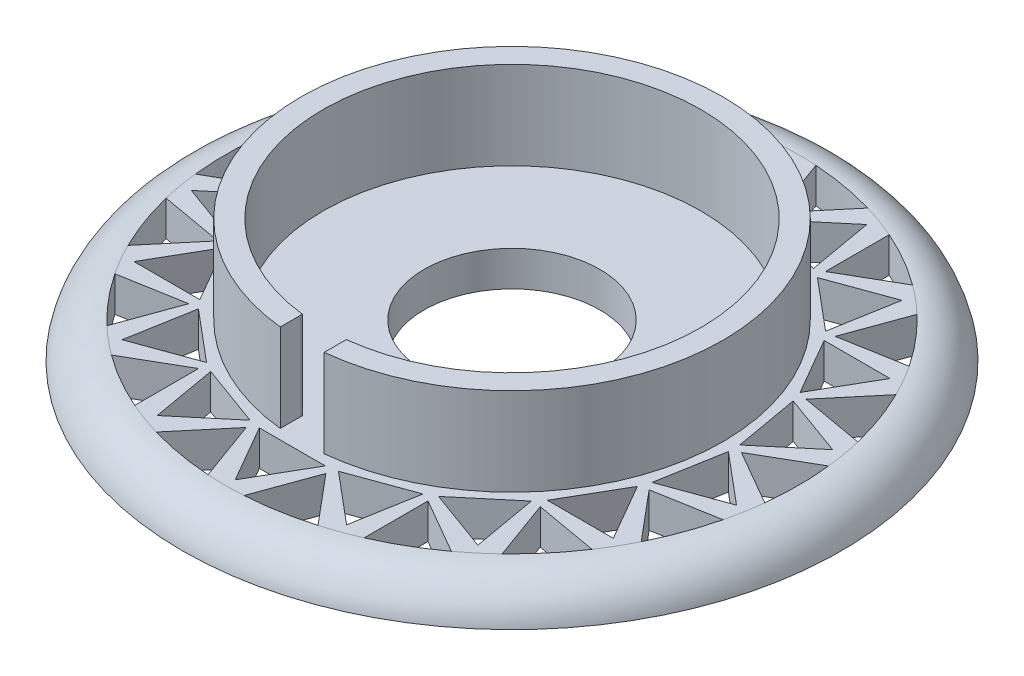
from build123d import *

# Parameters (mm, degrees)
SKETCH1_R           = 75
BOSS_EXTRUDE1_DEPTH = 8
SKETCH2_R           = 48
SKETCH2_R_2         = 43
BOSS_EXTRUDE3_DEPTH = 20
CUT_EXTRUDE2_START  = -20
CUT_EXTRUDE2_DEPTH  = 20
FILLET1_R           = 10
CUT_EXTRUDE3_DEPTH  = 108.935165725
CIRPATTERN1_COUNT   = 18
SKETCH9_R           = 20
CUT_EXTRUDE4_DEPTH  = 108.935165725


with BuildPart() as part:
    # Sketch1 → Boss-Extrude1 (new body)
    with BuildSketch(Plane(origin=(0, 0, 0), x_dir=(1, 0, 0), z_dir=(0, 1, 0))):
        with Locations(Location((0, 0, 0), (0, 0, 270))):
            Circle(SKETCH1_R)
    extrude(amount=BOSS_EXTRUDE1_DEPTH)

    # Sketch2 → Boss-Extrude3 (add)
    with BuildSketch(Plane(origin=(0, 8, 0), x_dir=(1, 0, 0), z_dir=(0, 1, 0))):
        with Locations(Location((0, 0, 0), (0, 0, 270))):
            Circle(SKETCH2_R)
        with Locations(Location((0, 0, 0), (0, 0, 270))):
            Circle(SKETCH2_R_2, mode=Mode.SUBTRACT)
    extrude(amount=BOSS_EXTRUDE3_DEPTH)

    # Sketch7 → Cut-Extrude2 (cut)
    with BuildSketch(Plane(origin=(0, 28, 0), x_dir=(1, 0, 0), z_dir=(0, 1, 0)).offset(CUT_EXTRUDE2_START)):
        with BuildLine():
            Line((0, -43), (-5, -43))
            Line((-5, -43), (-5, -47.738873049))
            ThreePointArc((-5, -47.738873049), (-2.503407043, -47.934673809), (0, -48))
            ThreePointArc((0, -48), (2.503407043, -47.934673809), (5, -47.738873049))
            Line((5, -47.738873049), (5, -43))
            Line((5, -43), (0, -43))
        make_face()
        with BuildLine():
            ThreePointArc((0, -48), (-2.503407043, -47.934673809), (-5, -47.738873049))
            Line((-5, -47.738873049), (-5, -48))
            Line((-5, -48), (0, -48))
        make_face()
        with BuildLine():
            ThreePointArc((5, -47.738873049), (2.503407043, -47.934673809), (0, -48))
            Line((0, -48), (5, -48))
            Line((5, -48), (5, -47.738873049))
        make_face()
        with BuildLine():
            ThreePointArc((4.966536902, -42.712217353), (2.4874338, -42.927994049), (0, -43))
            Line((0, -43), (5, -43))
            Line((5, -43), (4.966536902, -42.712217353))
        make_face()
        with BuildLine():
            Line((-4.966536902, -42.712217353), (-5, -43))
            Line((-5, -43), (0, -43))
            ThreePointArc((0, -43), (-2.4874338, -42.927994049), (-4.966536902, -42.712217353))
        make_face()
    extrude(amount=CUT_EXTRUDE2_DEPTH, mode=Mode.SUBTRACT)

    # Fillet1
    # the kernel refuses this fillet: 10 mm, written as the material it takes off along each edge
    with BuildSketch(Plane(origin=(0, 8, 0), x_dir=(0, 0, 1), z_dir=(-1, 0, 0))) as fillet1_piece_1:
        with BuildLine():
            CenterArc((65.202041029, -10), FILLET1_R, 11.536959033, 78.463040967)
            Line((65.202041029, 0), (65.202041029, 0.2))
            Line((65.202041029, 0.2), (75, 0.2))
            Line((75, 0.2), (75.2, 0))
            ThreePointArc((75.2, 0), (75.2, -4), (75.195959179, -7.96))
            Line((75.195959179, -7.96), (75, -8))
        make_face()
    revolve(axis=Axis((0, 8, 0), (0, 1, 0)), mode=Mode.SUBTRACT)

    # Sketch8 → Cut-Extrude3 (cut, through all)
    with BuildSketch(Plane(origin=(0, 8, 0), x_dir=(1, 0, 0), z_dir=(0, 1, 0))):
        with BuildLine():
            Line((-64.795971013, -7.265555367), (-52.211659972, 0))
            Line((-52.211659972, 0), (-64.795971013, 7.265555367))
            ThreePointArc((-64.795971013, 7.265555367), (-65.100444372, 3.638447047), (-65.202041029, 0))
            ThreePointArc((-65.202041029, 0), (-65.100444372, -3.638447047), (-64.795971013, -7.265555367))
        make_face()
        Polygon((-50.542748983, 1.296350736), (-47.938026318, 16.068467031), (-62.03341563, 10.938164881), align=None)
    cut_extrude3 = extrude(amount=-CUT_EXTRUDE3_DEPTH, mode=Mode.SUBTRACT)

    # CirPattern1: Cut-Extrude3 ×18 about axis
    cirpattern1_axis = Axis((0, 0, 0), (0, 1, 0))
    for i in range(1, CIRPATTERN1_COUNT):
        add(cut_extrude3.rotate(cirpattern1_axis, i * 360 / CIRPATTERN1_COUNT), mode=Mode.SUBTRACT)

    # Sketch9 → Cut-Extrude4 (cut, through all)
    with BuildSketch(Plane(origin=(0, 8, 0), x_dir=(1, 0, 0), z_dir=(0, 1, 0))):
        with Locations(Location((0, 0, 0), (0, 0, 270))):
            Circle(SKETCH9_R)
    extrude(amount=-CUT_EXTRUDE4_DEPTH, mode=Mode.SUBTRACT)


solid = part.part
